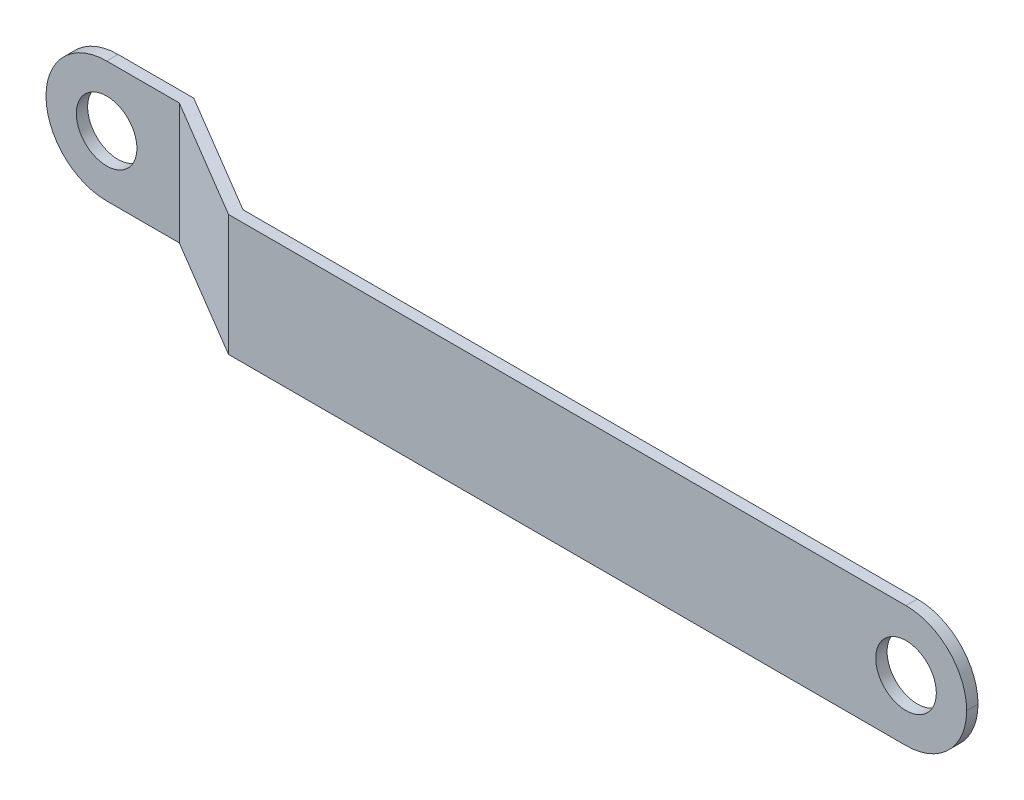
from build123d import *

# Parameters (mm, degrees)
EXTRUDE_1_DEPTH          = 8
FILLET_1_R               = 8
CUT_EXTRUDE_1_DEPTH      = 132.587423411
CUT_EXTRUDE_1_DEPTH_BACK = 132.587423411
SKETCH_2_R               = 4


with BuildPart() as part:
    # 草图1 → 拉伸-薄壁1 (new, symmetric)
    with BuildSketch(Plane(origin=(0, 0, 0), x_dir=(1, 0, 0), z_dir=(0, 1, 0))):
        Polygon((0, 0), (18, 0), (34, -9.5), (131, -9.5), (131, -11), (33.588243042, -11), (17.588243042, -1.5), (0, -1.5), align=None)
    extrude(amount=EXTRUDE_1_DEPTH, both=True)

    # 圆角1
    fillet_1_edges = [part.edges().sort_by_distance(p)[0] for p in [
        (131, -8, 10.25),
        (131, 8, 10.25),
        (0, -8, 0.75),
        (0, 8, 0.75),
    ]]
    fillet(fillet_1_edges, radius=FILLET_1_R - 0.0001)  # a hair under: the kernel refuses the full size

    # 草图2 → 切除-拉伸1 (cut, two sides: drawn at the far end of the back side and taken through both)
    with BuildSketch(Plane.XY.offset(1.5).offset(-CUT_EXTRUDE_1_DEPTH_BACK)):
        with Locations((8, 0)):
            Circle(SKETCH_2_R)
        with Locations((123, 0)):
            Circle(SKETCH_2_R)
    extrude(amount=CUT_EXTRUDE_1_DEPTH + CUT_EXTRUDE_1_DEPTH_BACK, mode=Mode.SUBTRACT)


solid = part.part
